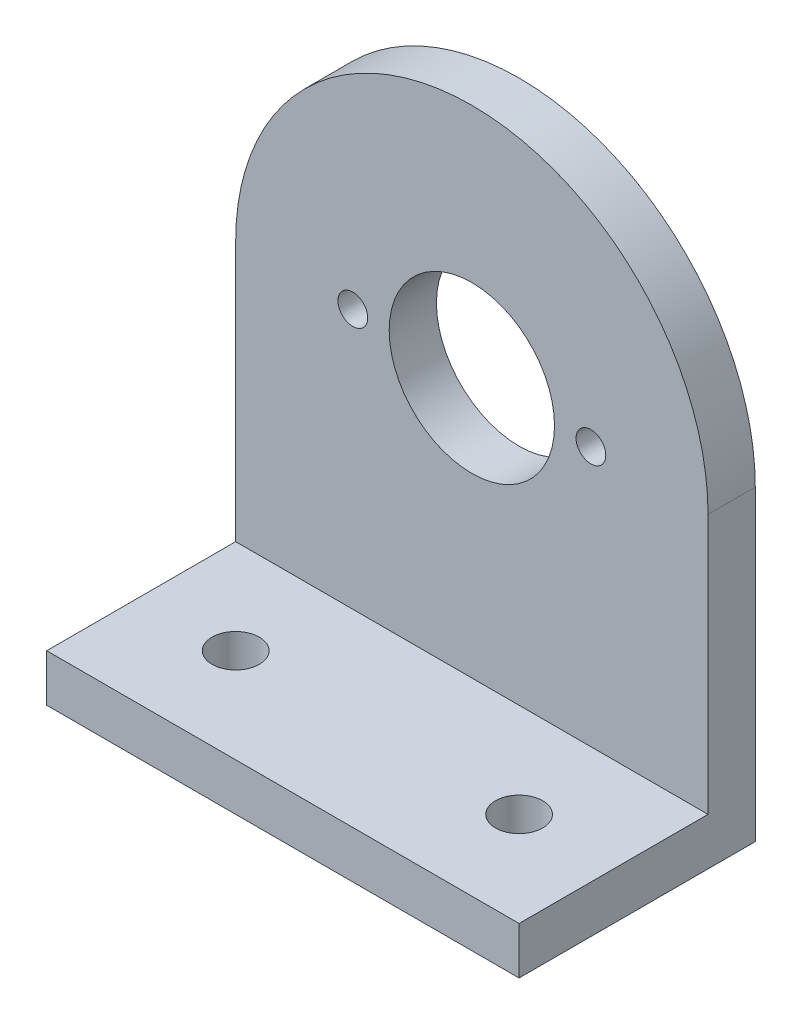
from build123d import *

# Parameters (mm, degrees)
SKETCH1_R                 = 15.875
SKETCH1_W                 = 31.75
SKETCH1_H                 = 20.6375
BOSS_EXTRUDE1_DEPTH       = 3.175
SKETCH3_R                 = 5.55625
CUT_EXTRUDE1_DEPTH        = 27.229804731
SKETCH4_W                 = 31.75
SKETCH4_H                 = 3.175
BOSS_EXTRUDE2_DEPTH       = 12.7
SKETCH5_R                 = 1.5875
CUT_EXTRUDE2_DEPTH        = 41.192289761
F_2_0MM_DOWEL_HOLE1_D     = 2
F_2_0MM_DOWEL_HOLE1_DEPTH = 12.7
F_2_0MM_DOWEL_HOLE1_TIP   = 0.600860619


with BuildPart() as part:
    # Sketch1 → Boss-Extrude1 (new body)
    with BuildSketch(Plane.XY):
        Circle(SKETCH1_R)
        with Locations((0, -10.31875)):
            Rectangle(SKETCH1_W, SKETCH1_H)
    extrude(amount=BOSS_EXTRUDE1_DEPTH)

    # Sketch3 → Cut-Extrude1 (cut, through all)
    with BuildSketch(Plane.XY.offset(3.175)):
        Circle(SKETCH3_R)
    extrude(amount=-CUT_EXTRUDE1_DEPTH, mode=Mode.SUBTRACT)

    # Sketch4 → Boss-Extrude2 (add)
    with BuildSketch(Plane.XY.offset(3.175)):
        with Locations((0, -19.05)):
            Rectangle(SKETCH4_W, SKETCH4_H)
    extrude(amount=BOSS_EXTRUDE2_DEPTH)

    # Sketch5 → Cut-Extrude2 (cut, through all)
    with BuildSketch(Plane(origin=(0, -17.4625, 0), x_dir=(1, 0, 0), z_dir=(0, 1, 0))):
        with Locations((-9.525, -9.525)):
            Circle(SKETCH5_R)
        with Locations((9.525, -9.525)):
            Circle(SKETCH5_R)
    extrude(amount=-CUT_EXTRUDE2_DEPTH, mode=Mode.SUBTRACT)

    # Ø2.0mm Dowel Hole1
    with Locations(Plane.XY.offset(3.175)):
        with Locations((-8.001, 0), (8.001, 0)):
            Hole(F_2_0MM_DOWEL_HOLE1_D / 2, depth=F_2_0MM_DOWEL_HOLE1_DEPTH)
            with Locations((0, 0, -(F_2_0MM_DOWEL_HOLE1_DEPTH + F_2_0MM_DOWEL_HOLE1_TIP / 2))):  # 118° drill point
                Cone(0, F_2_0MM_DOWEL_HOLE1_D / 2, F_2_0MM_DOWEL_HOLE1_TIP, mode=Mode.SUBTRACT)


solid = part.part
